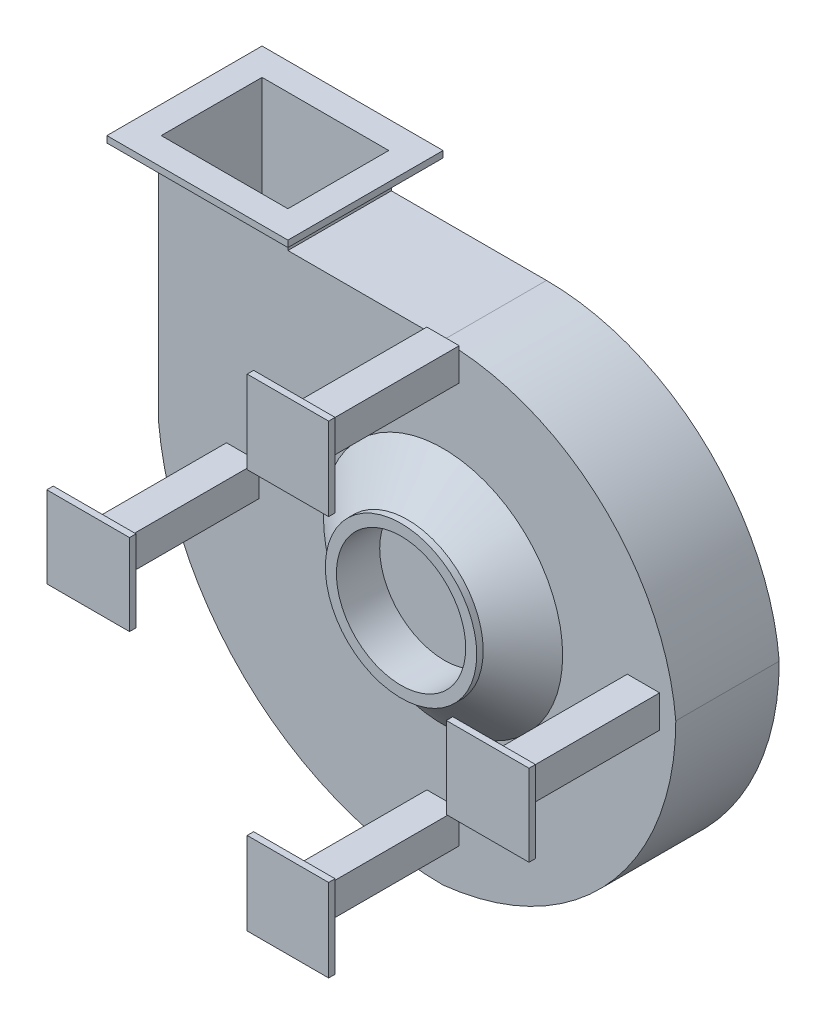
from build123d import *

# Parameters (mm, degrees)
BOSS_EXTRUDE1_DEPTH       = 160
SHELL4_START              = 2
SHELL4_DEPTH              = 156
SKETCH5_R                 = 90
CUT_EXTRUDE1_DEPTH        = 118
SKETCH6_R                 = 185
BOSS_EXTRUDE2_DEPTH       = 55
BOSS_EXTRUDE2_TAPER       = 51
SKETCH7_R                 = 117.080656391
BOSS_EXTRUDE3_DEPTH       = 10
SKETCH9_R                 = 100
CUT_EXTRUDE2_DEPTH        = 118
SKETCH11_R                = 10
CUT_EXTRUDE3_DEPTH        = 118
SKETCH12_W                = 280
SKETCH12_H                = 240
SKETCH12_W_2              = 196
SKETCH12_H_2              = 156
BOSS_EXTRUDE4_DEPTH       = 10
EXTRUDE_THIN1_OUTLINE_W   = 50
EXTRUDE_THIN1_OUTLINE_H   = 50
EXTRUDE_THIN1_OUTLINE_W_2 = 46
EXTRUDE_THIN1_OUTLINE_H_2 = 46
EXTRUDE_THIN1_DEPTH       = 230
BOSS_EXTRUDE6_START       = 230
SKETCH15_W                = 126
SKETCH15_H                = 128
SKETCH15_W_2              = 128
SKETCH15_H_2              = 126
BOSS_EXTRUDE6_DEPTH       = 10


# Read off the part's stored shape, not the designer's step: Shell4, Extrude-Thin1
with BuildPart() as part:
    # Sketch1 → Boss-Extrude1 (new body)
    with BuildSketch(Plane.XY):
        with BuildLine():
            Line((-181.424802111, -189.973614776), (-181.424802111, 184.026385224))
            Line((-181.424802111, 184.026385224), (18.575197889, 184.026385224))
            Line((18.575197889, 184.026385224), (18.575197889, 140.026385224))
            Line((18.575197889, 140.026385224), (258.575197889, 140.026385224))
            ThreePointArc((258.575197889, 140.026385224), (502.757506831, 45.043449524), (618.575197889, -189.973614776))
            ThreePointArc((618.575197889, -189.973614776), (515.322398935, -459.046095717), (258.575197889, -589.973614776))
            ThreePointArc((258.575197889, -589.973614776), (-38.746177057, -475.027127217), (-181.424802111, -189.973614776))
        make_face()
    extrude(amount=BOSS_EXTRUDE1_DEPTH)

    # Shell4 outline → Shell4 (cut)
    with BuildSketch(Plane.XY.offset(SHELL4_START)):
        with BuildLine():
            ThreePointArc((-179.424802111, -189.878268455), (-37.404584917, -473.543834805), (258.469922203, -587.973602181))
            ThreePointArc((258.469922203, -587.973602181), (513.841925832, -457.701371443), (616.57518844, -190.060584018))
            ThreePointArc((616.57518844, -190.060584018), (501.374009985, 43.598514633), (258.575197889, 138.026385224))
            Line((258.575197889, 138.026385224), (16.575197889, 138.026385224))
            Line((16.575197889, 138.026385224), (16.575197889, 184.026385224))
            Line((16.575197889, 184.026385224), (-179.424802111, 184.026385224))
            Line((-179.424802111, 184.026385224), (-179.424802111, -189.878268455))
        make_face()
    extrude(amount=SHELL4_DEPTH, mode=Mode.SUBTRACT)

    # Sketch5 → Cut-Extrude1 (cut)
    with BuildSketch(Plane.XY.offset(160)):
        with Locations((258.575197889, -189.973614776)):
            Circle(SKETCH5_R)
    extrude(amount=-CUT_EXTRUDE1_DEPTH, mode=Mode.SUBTRACT)

    # Sketch6 → Boss-Extrude2 (add)
    with BuildSketch(Plane.XY.offset(160)):
        with Locations((258.575197889, -189.973614776)):
            Circle(SKETCH6_R)
    extrude(amount=BOSS_EXTRUDE2_DEPTH, taper=BOSS_EXTRUDE2_TAPER)

    # Sketch7 → Boss-Extrude3 (add)
    with BuildSketch(Plane.XY.offset(215)):
        with Locations((258.575197889, -189.973614776)):
            Circle(SKETCH7_R)
    extrude(amount=BOSS_EXTRUDE3_DEPTH)

    # Sketch9 → Cut-Extrude2 (cut)
    with BuildSketch(Plane.XY.offset(225)):
        with Locations((258.575197889, -189.973614776)):
            Circle(SKETCH9_R)
    extrude(amount=-CUT_EXTRUDE2_DEPTH, mode=Mode.SUBTRACT)

    # Sketch11 → Cut-Extrude3 (cut)
    with BuildSketch(Plane(origin=(0, 0, 0), x_dir=(-1, 0, 0), z_dir=(0, 0, -1))):
        with Locations((-258.575197889, -189.973614776)):
            Circle(SKETCH11_R)
    extrude(amount=-CUT_EXTRUDE3_DEPTH, mode=Mode.SUBTRACT)

    # Sketch12 → Boss-Extrude4 (add)
    with BuildSketch(Plane(origin=(0, 184.026385224, 0), x_dir=(1, 0, 0), z_dir=(0, 1, 0))):
        with Locations((-81.424802111, -80)):
            Rectangle(SKETCH12_W, SKETCH12_H)
        with Locations((-81.424802111, -80)):
            Rectangle(SKETCH12_W_2, SKETCH12_H_2, mode=Mode.SUBTRACT)
    extrude(amount=BOSS_EXTRUDE4_DEPTH)

    # Extrude-Thin1 outline → Extrude-Thin1 (add)
    # profile 1 of 4: a face of its own
    with BuildSketch(Plane.XY.offset(160)):
        with Locations((-51.424802111, -189.973614776)):
            Rectangle(EXTRUDE_THIN1_OUTLINE_W, EXTRUDE_THIN1_OUTLINE_H)
        with Locations((-51.424802111, -189.973614776)):
            Rectangle(EXTRUDE_THIN1_OUTLINE_W_2, EXTRUDE_THIN1_OUTLINE_H_2, mode=Mode.SUBTRACT)
    # profile 2 of 4: a face of its own
    with BuildSketch(Plane.XY.offset(160)):
        with Locations((568.575197889, -189.973614776)):
            Rectangle(EXTRUDE_THIN1_OUTLINE_W, EXTRUDE_THIN1_OUTLINE_H)
        with Locations((568.575197889, -189.973614776)):
            Rectangle(EXTRUDE_THIN1_OUTLINE_W_2, EXTRUDE_THIN1_OUTLINE_H_2, mode=Mode.SUBTRACT)
    # profile 3 of 4: a face of its own
    with BuildSketch(Plane.XY.offset(160)):
        with Locations((258.575197889, 120.026385224)):
            Rectangle(EXTRUDE_THIN1_OUTLINE_W, EXTRUDE_THIN1_OUTLINE_H)
        with Locations((258.575197889, 120.026385224)):
            Rectangle(EXTRUDE_THIN1_OUTLINE_W_2, EXTRUDE_THIN1_OUTLINE_H_2, mode=Mode.SUBTRACT)
    # profile 4 of 4: a face of its own
    with BuildSketch(Plane.XY.offset(160)):
        with Locations((258.575197889, -499.973614776)):
            Rectangle(EXTRUDE_THIN1_OUTLINE_W, EXTRUDE_THIN1_OUTLINE_H)
        with Locations((258.575197889, -499.973614776)):
            Rectangle(EXTRUDE_THIN1_OUTLINE_W_2, EXTRUDE_THIN1_OUTLINE_H_2, mode=Mode.SUBTRACT)
    extrude(amount=EXTRUDE_THIN1_DEPTH)

    # Sketch15 → Boss-Extrude6 (add)
    with BuildSketch(Plane.XY.offset(160).offset(BOSS_EXTRUDE6_START)):
        with Locations((258.575197889, -498.973614776)):
            Rectangle(SKETCH15_W, SKETCH15_H)
        with Locations((-50.424802111, -189.973614776)):
            Rectangle(SKETCH15_W_2, SKETCH15_H_2)
        with Locations((258.575197889, 119.026385224)):
            Rectangle(SKETCH15_W, SKETCH15_H)
        with Locations((567.575197889, -189.973614776)):
            Rectangle(SKETCH15_W_2, SKETCH15_H_2)
    extrude(amount=BOSS_EXTRUDE6_DEPTH)


solid = part.part
